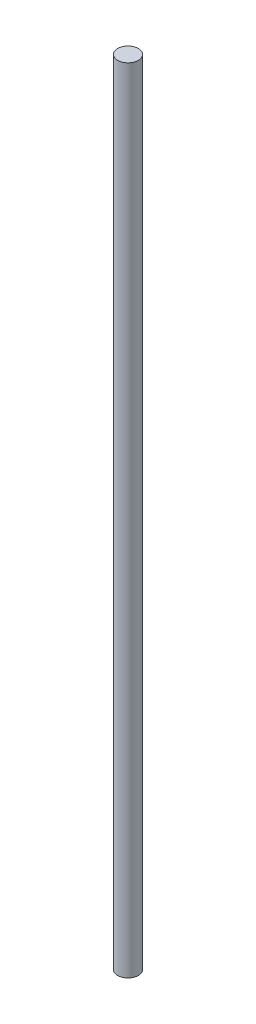
from build123d import *

# Parameters (mm, degrees)
SKETCH1_R           = 7.9375
BOSS_EXTRUDE1_DEPTH = 304.8


with BuildPart() as part:
    # Sketch1 → Boss-Extrude1 (new, symmetric)
    with BuildSketch(Plane(origin=(0, 0, 0), x_dir=(1, 0, 0), z_dir=(0, 1, 0))):
        Circle(SKETCH1_R)
    extrude(amount=BOSS_EXTRUDE1_DEPTH, both=True)


solid = part.part
